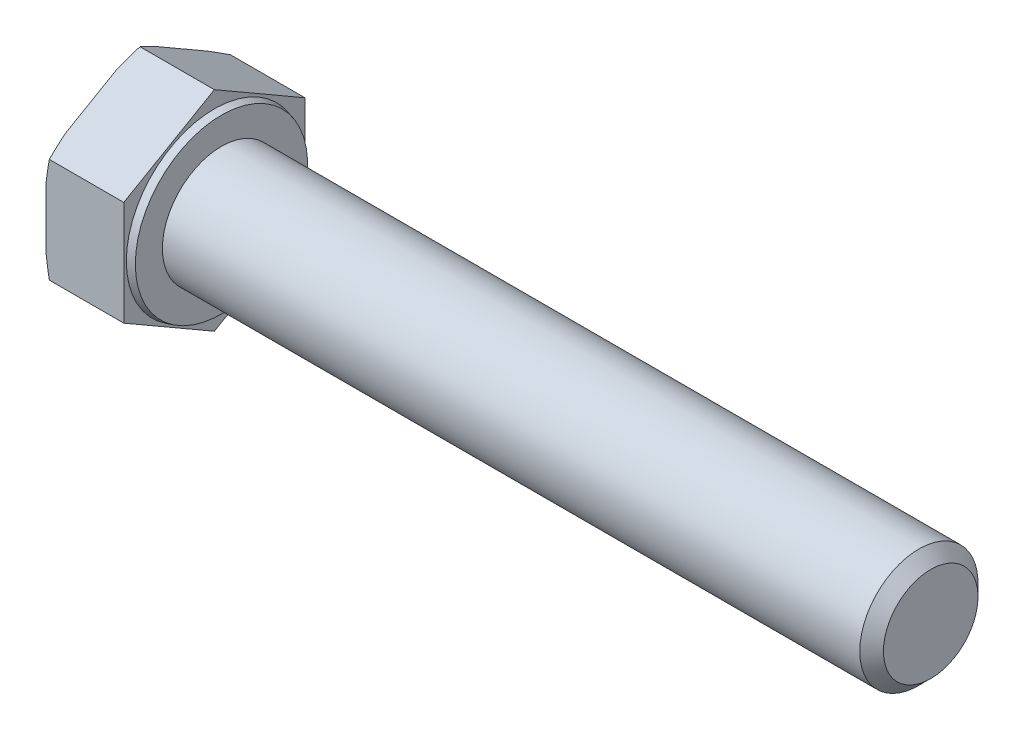
from build123d import *

# Parameters (mm, degrees)
SKETCH_2_OUTSIDE_W  = 34.038
SKETCH_2_OUTSIDE_H  = 34.038
CUT_EXTRUDE_1_DEPTH = 69.335915886
CHAMFER_1_SIZE      = 1


with BuildPart() as part:
    # Эскиз1 → Повернуть1 (revolve)
    with BuildSketch(Plane.XY):
        Polygon((-6.58, 0), (-6.58, 8.85), (0, 8.85), (0, 7.448974596), (0.6, 7.288205081), (0.6, 5), (60.6, 5), (60.6, 0), align=None)
    revolve(axis=Axis((-1000, 0, 0), (1, 0, 0)))

    # Эскиз2 outside → Вырез-Вытянуть1 (cut, through all)
    with BuildSketch(Plane.ZY.offset(6.58)):
        Rectangle(SKETCH_2_OUTSIDE_W, SKETCH_2_OUTSIDE_H)
        Polygon((0, -8.85), (7.664324823, -4.425), (7.664324823, 4.425), (0, 8.85), (-7.664324823, 4.425), (-7.664324823, -4.425), align=None, mode=Mode.SUBTRACT)
    extrude(amount=-CUT_EXTRUDE_1_DEPTH, mode=Mode.SUBTRACT)

    # Эскиз4 → Вырез-Повернуть1 (revolve, cut)
    with BuildSketch(Plane.XY):
        Polygon((-6.58, 8.075), (-6.297923068, 8.85), (-6.58, 8.85), align=None)
    revolve(axis=Axis((-1000, 0, 0), (1, 0, 0)), mode=Mode.SUBTRACT)

    # Фаска1
    chamfer_1_edges = [part.edges().sort_by_distance(p)[0] for p in [
        (60.6, -5, 0),
    ]]
    chamfer(chamfer_1_edges, length=CHAMFER_1_SIZE)


solid = part.part
